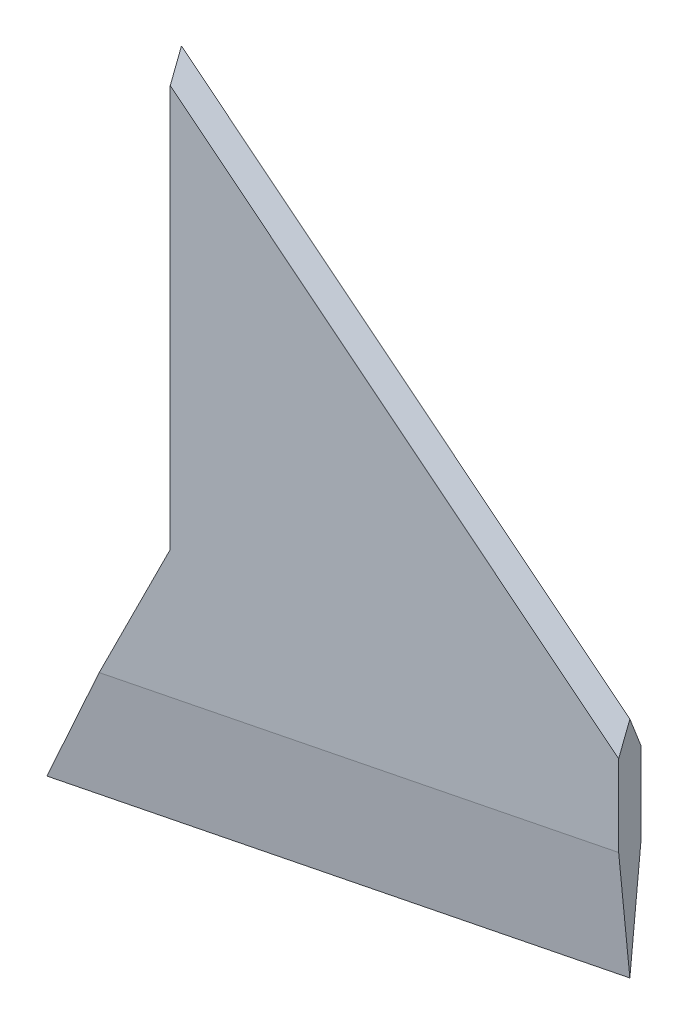
from build123d import *

# Parameters (mm, degrees)
BOSS_EXTRUDE1_DEPTH = 5
CHAMFER6_SIZE       = 5
CHAMFER6_SIZE2      = 2.5
CHAMFER7_SIZE2      = 5
CHAMFER7_SIZE       = 2.5
CHAMFER8_SIZE       = 2.5
CHAMFER8_SIZE2      = 25
CHAMFER9_SIZE       = 2.5
CHAMFER9_SIZE_2     = 25


# Some blends are built 0.0001 mm under size
with BuildPart() as part:
    # Sketch1 → Boss-Extrude1 (new body)
    with BuildSketch(Plane.XY):
        Polygon((-30, -6), (0, 0), (0, 54), align=None)
        Polygon((100, 20), (0, 0), (0, 150), (100, 70), align=None)
    extrude(amount=BOSS_EXTRUDE1_DEPTH)

    # Chamfer6
    chamfer6_edges = [part.edges().sort_by_distance(p)[0] for p in [
        (50, 110, 5),
    ]]
    chamfer6_side = [part.faces().sort_by_distance(p)[0] for p in [
        (37.795251311, 59.015726179, 5),
    ]]
    chamfer(chamfer6_edges, length=CHAMFER6_SIZE, length2=CHAMFER6_SIZE2, reference=chamfer6_side[0])

    # Chamfer7
    chamfer7_edges = [part.edges().sort_by_distance(p)[0] for p in [
        (50, 110, 0),
    ]]
    chamfer7_side = [part.faces().sort_by_distance(p)[0] for p in [
        (50, 110, 0.05),
    ]]
    chamfer(chamfer7_edges, length=CHAMFER7_SIZE - 0.0001, length2=CHAMFER7_SIZE2 - 0.0001, reference=chamfer7_side[0])  # a hair under: the kernel refuses the full size

    # Chamfer8
    chamfer8_edges = [part.edges().sort_by_distance(p)[0] for p in [
        (35, 7, 5),
    ]]
    chamfer8_side = [part.faces().sort_by_distance(p)[0] for p in [
        (35, 7, 2.5),
    ]]
    chamfer(chamfer8_edges, length=CHAMFER8_SIZE, length2=CHAMFER8_SIZE2, reference=chamfer8_side[0])

    # Chamfer9
    # the kernel refuses this chamfer: 25, 2.5 mm, written as the material it takes off along each edge
    with BuildSketch(Plane(origin=(-93.726044684, -18.745208937, 0), x_dir=(0.07010860495922276, -0.3505430247961141, 0.933918824779468), z_dir=(0.9805806756909202, 0.19611613513818388, 0))) as chamfer9_piece_1:
        Polygon((CHAMFER9_SIZE * 0.933918824779, -CHAMFER9_SIZE * 0.357485144758), (-CHAMFER9_SIZE_2 * 0.357485144758, -CHAMFER9_SIZE_2 * 0.933918824779), (0, 0), align=None)
    extrude(amount=262.550645501, mode=Mode.SUBTRACT)


solid = part.part
